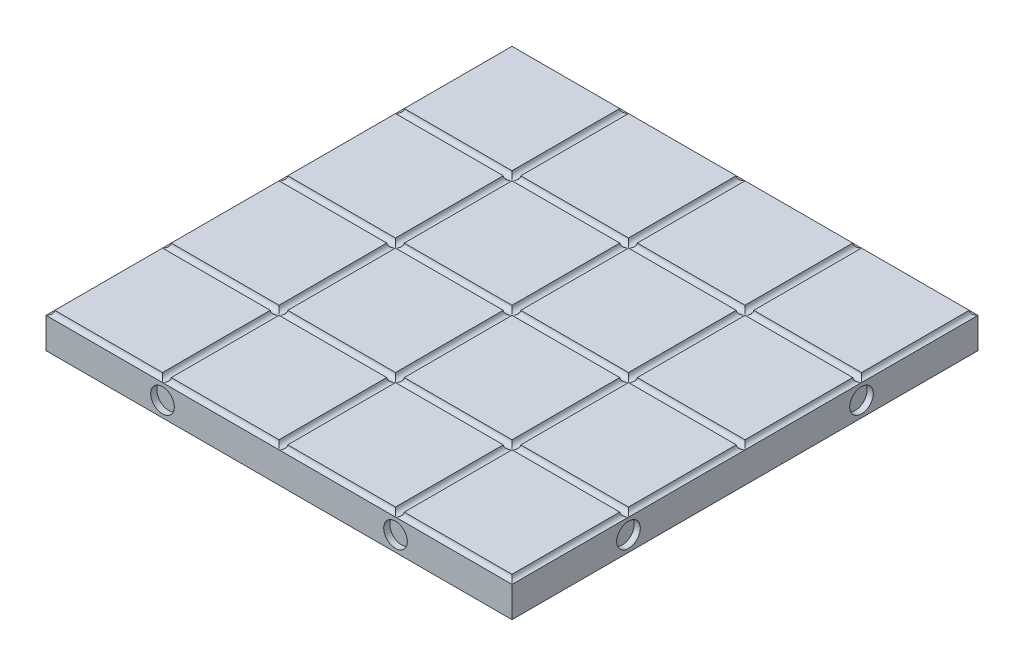
from build123d import *

# Parameters (mm, degrees)
SKETCH_1_W                  = 160
SKETCH_1_H                  = 160
EXTRUDE_1_DEPTH             = 12
SWEEP_1_PROFILE_R           = 1.5
PATTERN_LINEAR_1_COUNT      = 5
PATTERN_LINEAR_1_PITCH      = 40
SWEEP_2_PROFILE_R           = 1.5
PATTERN_LINEAR_2_COUNT      = 5
PATTERN_LINEAR_2_PITCH      = 40
PATTERN_LINEAR_2_COUNT_DIR2 = 5
PATTERN_LINEAR_2_PITCH_DIR2 = 40
SKETCH_181_R                = 4.05
CUT_EXTRUDE_1_DEPTH         = 2.1
PATTERN_CIRCULAR_1_COUNT    = 4
F_1_THE_OTHER_WAY_COUNT     = 4


with BuildPart() as part:
    # Эскиз1 → Бобышка-Вытянуть1 (new body)
    with BuildSketch(Plane(origin=(0, 0, 0), x_dir=(1, 0, 0), z_dir=(0, 1, 0))):
        Rectangle(SKETCH_1_W, SKETCH_1_H)
    extrude(amount=-EXTRUDE_1_DEPTH)

    # Вырез-По траектории1: sweep along a path in Эскиз2
    with BuildLine(Plane(origin=(0, 0, 0), x_dir=(1, 0, 0), z_dir=(0, 1, 0))) as sweep_1_path:
        Line((-80, 80), (-80, -80))
    # Вырез-По траектории1 profile (on start of the path) → Вырез-По траектории1 (sweep, cut)
    with BuildSketch(Plane(origin=(-80, 0, -80), x_dir=(1, 0, 0), z_dir=(0, 0, 1))):
        Circle(SWEEP_1_PROFILE_R)
    sweep_1 = sweep(path=sweep_1_path.line, mode=Mode.SUBTRACT)

    # Линейный массив1: Вырез-По траектории1 ×5
    with Locations(*[(i * PATTERN_LINEAR_1_PITCH, 0, 0) for i in range(1, PATTERN_LINEAR_1_COUNT)]):
        add(sweep_1, mode=Mode.SUBTRACT)

    # Вырез-По траектории2: sweep along a path in Эскиз180
    with BuildLine(Plane(origin=(0, 0, 0), x_dir=(1, 0, 0), z_dir=(0, 1, 0))) as sweep_2_path:
        Line((-80, -80), (80, -80))
    # Вырез-По траектории2 profile (on start of the path) → Вырез-По траектории2 (sweep, cut)
    with BuildSketch(Plane(origin=(-80, 0, 80), x_dir=(0, 0, 1), z_dir=(1, 0, 0))):
        Circle(SWEEP_2_PROFILE_R)
    sweep_2 = sweep(path=sweep_2_path.line, mode=Mode.SUBTRACT)

    # Линейный массив2: Sweep 2 5 × 5
    with Locations(*[(i * PATTERN_LINEAR_2_PITCH, 0, -j * PATTERN_LINEAR_2_PITCH_DIR2) for i in range(PATTERN_LINEAR_2_COUNT) for j in range(PATTERN_LINEAR_2_COUNT_DIR2) if (i, j) != (0, 0)]):
        add(sweep_2, mode=Mode.SUBTRACT)

    # Эскиз181 → Вырез-Вытянуть1 (cut)
    with BuildSketch(Plane.XY.offset(80)):
        with Locations((-40, -6.75)):
            Circle(SKETCH_181_R)
        with Locations((40, -6.75)):
            Circle(SKETCH_181_R)
    cut_extrude_1 = extrude(amount=-CUT_EXTRUDE_1_DEPTH, mode=Mode.SUBTRACT)

    # Круговой массив1: Вырез-Вытянуть1 ×4 about axis
    pattern_circular_1_axis = Axis((0, -12, 0), (0, -1, 0))
    for i in range(1, PATTERN_CIRCULAR_1_COUNT):
        add(cut_extrude_1.rotate(pattern_circular_1_axis, i * 360 / PATTERN_CIRCULAR_1_COUNT), mode=Mode.SUBTRACT)

    # 1 the other way: Вырез-Вытянуть1 ×4 about axis
    f_1_the_other_way_axis = Axis((0, -12, 0), (0, 1, 0))
    for i in range(1, F_1_THE_OTHER_WAY_COUNT):
        add(cut_extrude_1.rotate(f_1_the_other_way_axis, i * 360 / F_1_THE_OTHER_WAY_COUNT), mode=Mode.SUBTRACT)


solid = part.part
